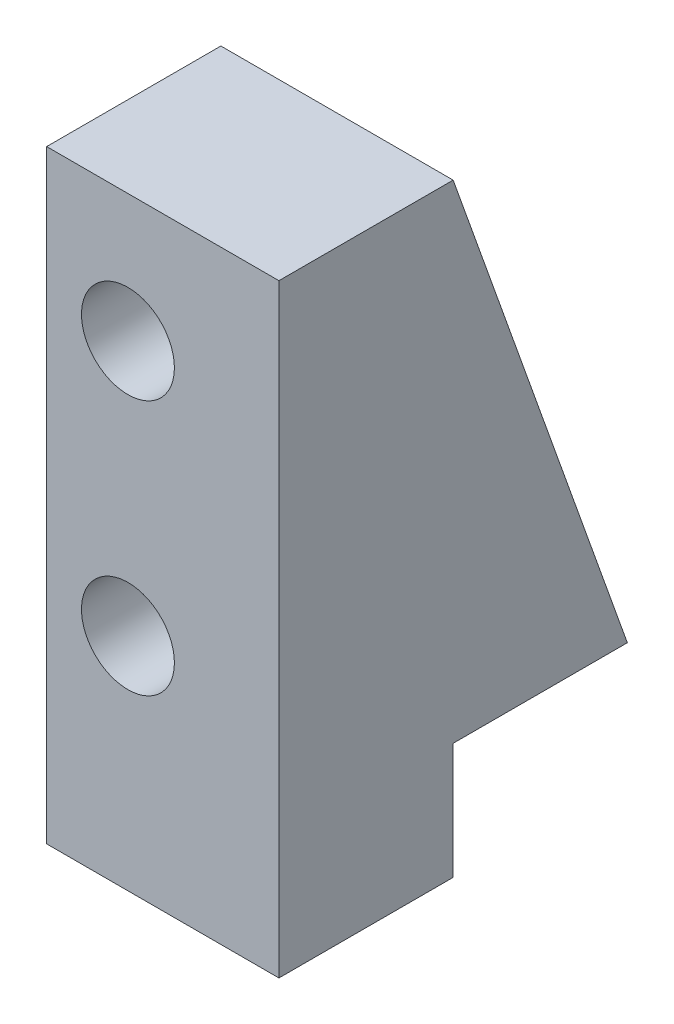
from build123d import *

# Parameters (mm, degrees)
SALIENTE_EXTRUIR1_DEPTH    = 10
CROQUIS2_W                 = 5
CROQUIS2_H                 = 45
CORTAR_EXTRUIR1_DEPTH      = 12.5
CROQUIS4_W                 = 73.322426794
CROQUIS4_H                 = 5
SALIENTE_EXTRUIR2_DEPTH    = 30
CROQUIS5_W                 = 2.5
CROQUIS5_H                 = 5
SALIENTE_EXTRUIR3_DEPTH    = 50
CROQUIS6_W                 = 55.637494131
CROQUIS6_H                 = 64.414873678
CORTAR_EXTRUIR2_DEPTH      = 55
CROQUIS7_R                 = 1.5
CORTAR_EXTRUIR3_DEPTH      = 5
CROQUIS8_W                 = 39.981329184
CROQUIS8_H                 = 5
CORTAR_EXTRUIR4_DEPTH      = 10
CROQUIS9_W                 = 10
CROQUIS9_H                 = 7.5
SALIENTE_EXTRUIR4_DEPTH    = 21
CROQUIS11_R                = 2
CORTAR_EXTRUIR5_DEPTH      = 21
SALIENTE_EXTRUIR5_START    = -40
CROQUIS12_W                = 21.008716652
CROQUIS12_H                = 5
SALIENTE_EXTRUIR5_DEPTH    = 40
CORTAR_EXTRUIR6_DEPTH      = 62.200166864
CROQUIS15_W                = 5
CROQUIS15_H                = 10
SALIENTE_EXTRUIR6_DEPTH    = 31.1
SALIENTE_EXTRUIR7_DEPTH    = 10
SALIENTE_EXTRUIR8_DEPTH    = 5
CORTAR_EXTRUIR7_START      = -13
CROQUIS21_R                = 1.5
CORTAR_EXTRUIR7_DEPTH      = 13
CORTAR_EXTRUIR10_START     = -52.1
CORTAR_EXTRUIR10_OUTLINE_W = 10
CORTAR_EXTRUIR10_OUTLINE_H = 7.5
CORTAR_EXTRUIR10_DEPTH     = 52.1
SALIENTE_EXTRUIR9_DEPTH    = 10
CROQUIS24_R                = 2
CORTAR_EXTRUIR11_DEPTH     = 10


# Read off the part's stored shape, not the designer's step: Cortar-Extruir10
with BuildPart() as part:
    # Croquis1 → Saliente-Extruir1 (new body)
    with BuildSketch(Plane.XY):
        with BuildLine():
            Line((-35, 10), (-35, 0))
            Line((-35, 0), (-30, 0))
            Line((-30, 0), (-30, 10))
            Line((-30, 10), (-20, 10))
            Line((-20, 10), (-20, 35.723707224))
            ThreePointArc((-20, 35.723707224), (0, 55.723707224), (20, 35.723707224))
            Line((20, 35.723707224), (20, 10))
            Line((20, 10), (30, 10))
            Line((30, 10), (30, 0))
            Line((30, 0), (35, 0))
            Line((35, 0), (35, 10))
            Line((35, 10), (39, 10))
            Line((39, 10), (39, 20))
            Line((39, 20), (14.443351433, 84.048407017))
            Line((14.443351433, 84.048407017), (13.447706691, 86.645237749))
            ThreePointArc((13.447706691, 86.645237749), (0, 95), (-13.447706691, 86.645237749))
            Line((-13.447706691, 86.645237749), (-14.443351433, 84.048407017))
            Line((-14.443351433, 84.048407017), (-39, 20))
            Line((-39, 20), (-39, 10))
            Line((-39, 10), (-35, 10))
        make_face()
        with BuildLine():
            ThreePointArc((1.5, 60), (0, 58.5), (-1.5, 60))
            Line((-1.5, 60), (-1.5, 80))
            ThreePointArc((-1.5, 80), (0, 81.5), (1.5, 80))
            Line((1.5, 80), (1.5, 60))
        make_face(mode=Mode.SUBTRACT)
    extrude(amount=SALIENTE_EXTRUIR1_DEPTH)

    # Croquis2 → Cortar-Extruir1 (cut, symmetric)
    with BuildSketch(Plane(origin=(0, 0, 0), x_dir=(0, 0, -1), z_dir=(1, 0, 0))):
        with Locations((-5, 72.5)):
            Rectangle(CROQUIS2_W, CROQUIS2_H)
    extrude(amount=CORTAR_EXTRUIR1_DEPTH, both=True, mode=Mode.SUBTRACT)

    # Croquis4 → Saliente-Extruir2 (add)
    with BuildSketch(Plane(origin=(0, 0, 0), x_dir=(-1, 0, 0), z_dir=(0, 0, -1))):
        with Locations((0, 28.6)):
            Rectangle(CROQUIS4_W, CROQUIS4_H)
    extrude(amount=SALIENTE_EXTRUIR2_DEPTH)

    # Croquis5 → Saliente-Extruir3 (add)
    with BuildSketch(Plane(origin=(-20, 0, 0), x_dir=(0, 0, -1), z_dir=(1, 0, 0))):
        with Locations((-8.75, 28.6)):
            Rectangle(CROQUIS5_W, CROQUIS5_H)
    extrude(amount=SALIENTE_EXTRUIR3_DEPTH)

    # Croquis6 → Cortar-Extruir2 (cut, symmetric)
    with BuildSketch(Plane(origin=(-20, 0, 0), x_dir=(0, 0, -1), z_dir=(1, 0, 0))):
        with Locations((17.818747066, 63.307436839)):
            Rectangle(CROQUIS6_W, CROQUIS6_H)
    extrude(amount=CORTAR_EXTRUIR2_DEPTH, both=True, mode=Mode.SUBTRACT)

    # Croquis7 → Cortar-Extruir3 (cut)
    with BuildSketch(Plane.XY.offset(10)):
        with Locations((0, 28.6)):
            Circle(CROQUIS7_R)
    extrude(amount=-CORTAR_EXTRUIR3_DEPTH, mode=Mode.SUBTRACT)

    # Croquis8 → Cortar-Extruir4 (cut)
    with BuildSketch(Plane(origin=(0, 31.1, 0), x_dir=(1, 0, 0), z_dir=(0, 1, 0))):
        with Locations((-0.009335408, 2.5)):
            Rectangle(CROQUIS8_W, CROQUIS8_H)
    extrude(amount=-CORTAR_EXTRUIR4_DEPTH, mode=Mode.SUBTRACT)

    # Croquis9 → Saliente-Extruir4 (add)
    with BuildSketch(Plane(origin=(0, 31.1, 0), x_dir=(1, 0, 0), z_dir=(0, 1, 0))):
        with Locations((15.061213397, 24.25)):
            Rectangle(CROQUIS9_W, CROQUIS9_H)
        with Locations((-35.940317185, 24.25)):
            Rectangle(CROQUIS9_W, CROQUIS9_H)
    extrude(amount=SALIENTE_EXTRUIR4_DEPTH)

    # Croquis11 → Cortar-Extruir5 (cut)
    with BuildSketch(Plane.XY.offset(-20.5)):
        with Locations((13.560448106, 46.6)):
            Circle(CROQUIS11_R)
        with Locations((13.560448106, 35.6)):
            Circle(CROQUIS11_R)
        with Locations((-34.439551894, 46.6)):
            Circle(CROQUIS11_R)
        with Locations((-34.439551894, 35.6)):
            Circle(CROQUIS11_R)
    extrude(amount=-CORTAR_EXTRUIR5_DEPTH, mode=Mode.SUBTRACT)

    # Croquis12 → Saliente-Extruir5 (add)
    with BuildSketch(Plane(origin=(0, 0, -30), x_dir=(-1, 0, 0), z_dir=(0, 0, -1)).offset(SALIENTE_EXTRUIR5_START)):
        with Locations((32.834428277, 28.6)):
            Rectangle(CROQUIS12_W, CROQUIS12_H)
    extrude(amount=SALIENTE_EXTRUIR5_DEPTH)

    # Croquis13 → Cortar-Extruir6 (cut, through all)
    with BuildSketch(Plane(origin=(0, 31.1, 0), x_dir=(1, 0, 0), z_dir=(0, 1, 0))):
        Polygon((34.744175198, 0), (36.661213397, 0), (36.661213397, 30), (21.661213397, 30), align=None)
    extrude(amount=-CORTAR_EXTRUIR6_DEPTH, mode=Mode.SUBTRACT)

    # Croquis15 → Saliente-Extruir6 (add)
    with BuildSketch(Plane(origin=(0, 31.1, 0), x_dir=(1, 0, 0), z_dir=(0, 1, 0))):
        with Locations((0, 25)):
            Rectangle(CROQUIS15_W, CROQUIS15_H)
    extrude(amount=-SALIENTE_EXTRUIR6_DEPTH)

    # Croquis18 → Saliente-Extruir7 (add)
    with BuildSketch(Plane.XY.offset(10)):
        Polygon((-39, 10), (-43.338786603, 26.1), (-36.661213397, 26.1), align=None)
    extrude(amount=-SALIENTE_EXTRUIR7_DEPTH)


with BuildPart() as body_2:
    # Croquis20 → Saliente-Extruir8 (new body)
    with BuildSketch(Plane(origin=(0, 31.1, 0), x_dir=(1, 0, 0), z_dir=(0, 1, 0))):
        Polygon((-1.624735856, -15), (1.624735856, -15), (34.744175198, -10), (-43.338786603, -10), align=None)
    extrude(amount=-SALIENTE_EXTRUIR8_DEPTH)

    # Croquis21 → Cortar-Extruir7 (cut)
    with BuildSketch(Plane(origin=(0, 0, 7.5), x_dir=(-1, 0, 0), z_dir=(0, 0, -1)).offset(CORTAR_EXTRUIR7_START)):
        with Locations(Location((0, 28.6, 0), (0, 0, 180))):
            Circle(CROQUIS21_R)
    extrude(amount=CORTAR_EXTRUIR7_DEPTH, mode=Mode.SUBTRACT)


with BuildPart() as cortar_extruir10_tool:
    # Cortar-Extruir10 outline → Cortar-Extruir10 (new body)
    with BuildSketch(Plane(origin=(0, 52.1, 0), x_dir=(1, 0, 0), z_dir=(0, 1, 0)).offset(CORTAR_EXTRUIR10_START)):
        Polygon((1.624735856, -15), (34.744175198, -10), (39, -10), (39, 0), (34.744175198, 0), (21.661213397, 30), (-43.338786603, 30), (-43.338786603, -10), (-1.624735856, -15), align=None)
        Polygon((20, -7.5), (-20, -7.5), (-20, 5), (19.981329184, 5), (19.981329184, 0), (20, 0), align=None, mode=Mode.SUBTRACT)
        with Locations((15.061213397, 24.25)):
            Rectangle(CORTAR_EXTRUIR10_OUTLINE_W, CORTAR_EXTRUIR10_OUTLINE_H, mode=Mode.SUBTRACT)
    extrude(amount=CORTAR_EXTRUIR10_DEPTH)


with BuildPart() as part_1:
    add(part.part)

    # Cortar-Extruir10: cut by cortar_extruir10_tool
    add(cortar_extruir10_tool.part, mode=Mode.SUBTRACT)

    # Croquis23 → Saliente-Extruir9 (add)
    with BuildSketch(Plane.ZY.offset(-10.061213397)):
        Polygon((-28, 31.1), (-35.5, 31.1), (-28, 52.1), align=None)
    extrude(amount=-SALIENTE_EXTRUIR9_DEPTH)

    # Croquis24 → Cortar-Extruir11 (cut)
    with BuildSketch(Plane.XY.offset(-28)):
        with Locations((13.560448106, 46.6)):
            Circle(CROQUIS24_R)
        with Locations((13.560448106, 35.6)):
            Circle(CROQUIS24_R)
    extrude(amount=-CORTAR_EXTRUIR11_DEPTH, mode=Mode.SUBTRACT)


with BuildPart() as body_2_1:
    add(body_2.part)

    # Cortar-Extruir10: cut by cortar_extruir10_tool
    add(cortar_extruir10_tool.part, mode=Mode.SUBTRACT)


solid = part_1.part
